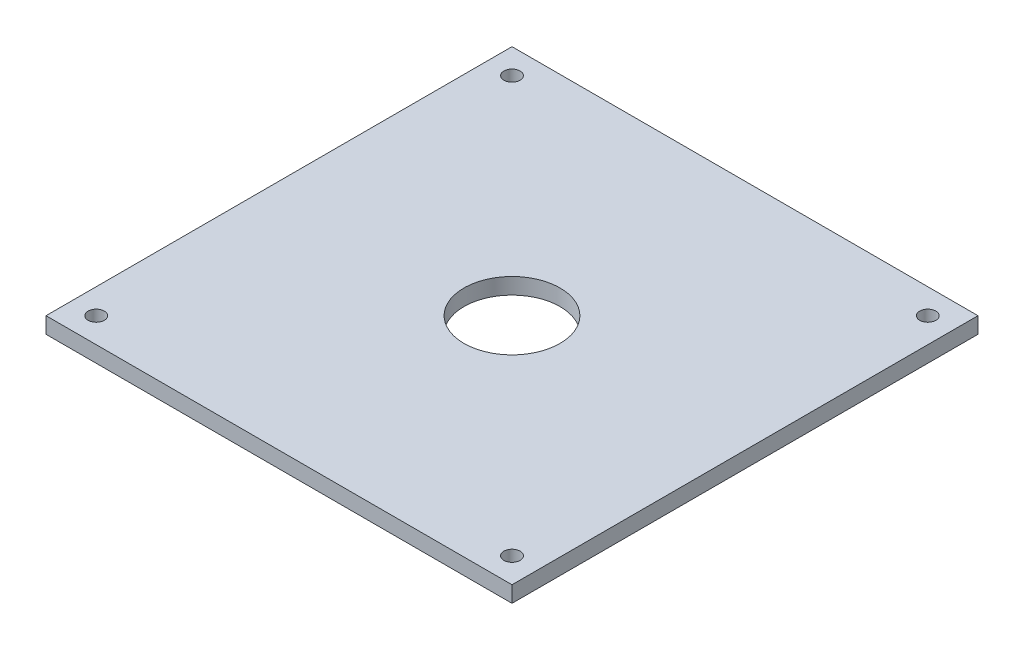
from build123d import *

# Parameters (mm, degrees)
SKETCH1_W           = 130
SKETCH1_H           = 130
SKETCH1_R           = 13.4
SKETCH1_R_2         = 2.25
BOSS_EXTRUDE1_DEPTH = 4.5


with BuildPart() as part:
    # Sketch1 → Boss-Extrude1 (new body)
    with BuildSketch(Plane(origin=(0, 0, 0), x_dir=(1, 0, 0), z_dir=(0, 1, 0))):
        with Locations((65, 65)):
            Rectangle(SKETCH1_W, SKETCH1_H)
        with Locations((65, 65)):
            Circle(SKETCH1_R, mode=Mode.SUBTRACT)
        with Locations((123, 123)):
            Circle(SKETCH1_R_2, mode=Mode.SUBTRACT)
        with Locations((123, 7)):
            Circle(SKETCH1_R_2, mode=Mode.SUBTRACT)
        with Locations((7, 7)):
            Circle(SKETCH1_R_2, mode=Mode.SUBTRACT)
        with Locations((7, 123)):
            Circle(SKETCH1_R_2, mode=Mode.SUBTRACT)
    extrude(amount=BOSS_EXTRUDE1_DEPTH)


solid = part.part
